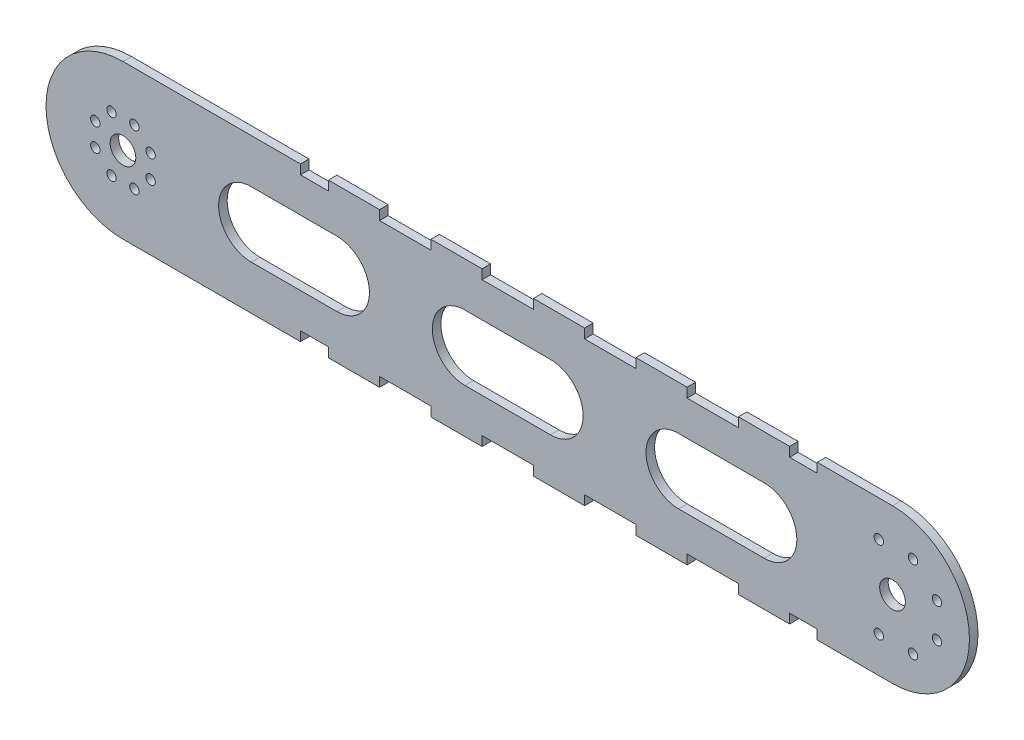
from build123d import *

# Parameters (mm, degrees)
SKETCH3_R           = 2.75
SKETCH3_R_2         = 7.5
BOSS_EXTRUDE1_DEPTH = 5
SKETCH3_3_W         = 16.34120562
SKETCH3_3_H         = 5.54
SKETCH3_3_W_2       = 30
SKETCH3_3_W_3       = 16.131491831
CUT_EXTRUDE1_DEPTH  = 477.194619152


with BuildPart() as part:
    # Sketch3 → Boss-Extrude1 (new body)
    with BuildSketch(Plane.XY):
        with BuildLine():
            ThreePointArc((-20.962749028, 45), (-65.962749028, 0), (-20.962749028, -45))
            Line((-20.962749028, -45), (429.037250972, -45))
            ThreePointArc((429.037250972, -45), (474.037250972, 0), (429.037250972, 45))
            Line((429.037250972, 45), (-20.962749028, 45))
        make_face()
        with Locations((-27.659709094, -16.167891819)):
            Circle(SKETCH3_R, mode=Mode.SUBTRACT)
        with Locations((-14.265788962, -16.167891819)):
            Circle(SKETCH3_R, mode=Mode.SUBTRACT)
        with Locations((-37.130640847, -6.696960066)):
            Circle(SKETCH3_R, mode=Mode.SUBTRACT)
        with Locations((-4.794857209, -6.696960066)):
            Circle(SKETCH3_R, mode=Mode.SUBTRACT)
        with Locations((-20.962749028, 0)):
            Circle(SKETCH3_R_2, mode=Mode.SUBTRACT)
        with BuildLine():
            ThreePointArc((54.069250972, -19.094555463), (34.974695509, 0), (54.069250972, 19.094555463))
            Line((54.069250972, 19.094555463), (104.069250972, 19.094555463))
            ThreePointArc((104.069250972, 19.094555463), (123.163806435, 0), (104.069250972, -19.094555463))
            Line((104.069250972, -19.094555463), (54.069250972, -19.094555463))
        make_face(mode=Mode.SUBTRACT)
        with Locations((421.037250972, -24)):
            Circle(SKETCH3_R, mode=Mode.SUBTRACT)
        with Locations((441.037250972, -24)):
            Circle(SKETCH3_R, mode=Mode.SUBTRACT)
        with BuildLine():
            ThreePointArc((179.037250972, -19.094555463), (159.942695509, 0), (179.037250972, 19.094555463))
            Line((179.037250972, 19.094555463), (229.037250972, 19.094555463))
            ThreePointArc((229.037250972, 19.094555463), (248.131806435, 0), (229.037250972, -19.094555463))
            Line((229.037250972, -19.094555463), (179.037250972, -19.094555463))
        make_face(mode=Mode.SUBTRACT)
        with BuildLine():
            ThreePointArc((304.005250972, -19.094555463), (284.910695509, 0), (304.005250972, 19.094555463))
            Line((304.005250972, 19.094555463), (354.005250972, 19.094555463))
            ThreePointArc((354.005250972, 19.094555463), (373.099806435, 0), (354.005250972, -19.094555463))
            Line((354.005250972, -19.094555463), (304.005250972, -19.094555463))
        make_face(mode=Mode.SUBTRACT)
        with Locations((455.037250972, -10)):
            Circle(SKETCH3_R, mode=Mode.SUBTRACT)
        with Locations((-37.130640847, 6.696960066)):
            Circle(SKETCH3_R, mode=Mode.SUBTRACT)
        with Locations((-4.794857209, 6.696960066)):
            Circle(SKETCH3_R, mode=Mode.SUBTRACT)
        with Locations((-27.659709094, 16.167891819)):
            Circle(SKETCH3_R, mode=Mode.SUBTRACT)
        with Locations((-14.265788962, 16.167891819)):
            Circle(SKETCH3_R, mode=Mode.SUBTRACT)
        with Locations((429.037250972, 0)):
            Circle(SKETCH3_R_2, mode=Mode.SUBTRACT)
        with Locations((455.037250972, 10)):
            Circle(SKETCH3_R, mode=Mode.SUBTRACT)
        with Locations((421.037250972, 24)):
            Circle(SKETCH3_R, mode=Mode.SUBTRACT)
        with Locations((441.037250972, 24)):
            Circle(SKETCH3_R, mode=Mode.SUBTRACT)
    extrude(amount=BOSS_EXTRUDE1_DEPTH)

    # Sketch3<3> → Cut-Extrude1 (cut, through all)
    with BuildSketch(Plane.XY):
        with Locations((90.978648162, 42.23)):
            Rectangle(SKETCH3_3_W, SKETCH3_3_H)
        with Locations((144.093250972, 42.23)):
            Rectangle(SKETCH3_3_W_2, SKETCH3_3_H)
        with Locations((376.934996888, 42.23)):
            Rectangle(SKETCH3_3_W_3, SKETCH3_3_H)
        with Locations((204.037250972, 42.23)):
            Rectangle(SKETCH3_3_W_2, SKETCH3_3_H)
        with Locations((323.925250972, 42.23)):
            Rectangle(SKETCH3_3_W_2, SKETCH3_3_H)
        with Locations((263.981250972, 42.23)):
            Rectangle(SKETCH3_3_W_2, SKETCH3_3_H)
    cut_extrude1 = extrude(amount=CUT_EXTRUDE1_DEPTH, mode=Mode.SUBTRACT)

    # Mirror1: Cut-Extrude1 across plane
    add(cut_extrude1.mirror(Plane.ZX), mode=Mode.SUBTRACT)


solid = part.part
